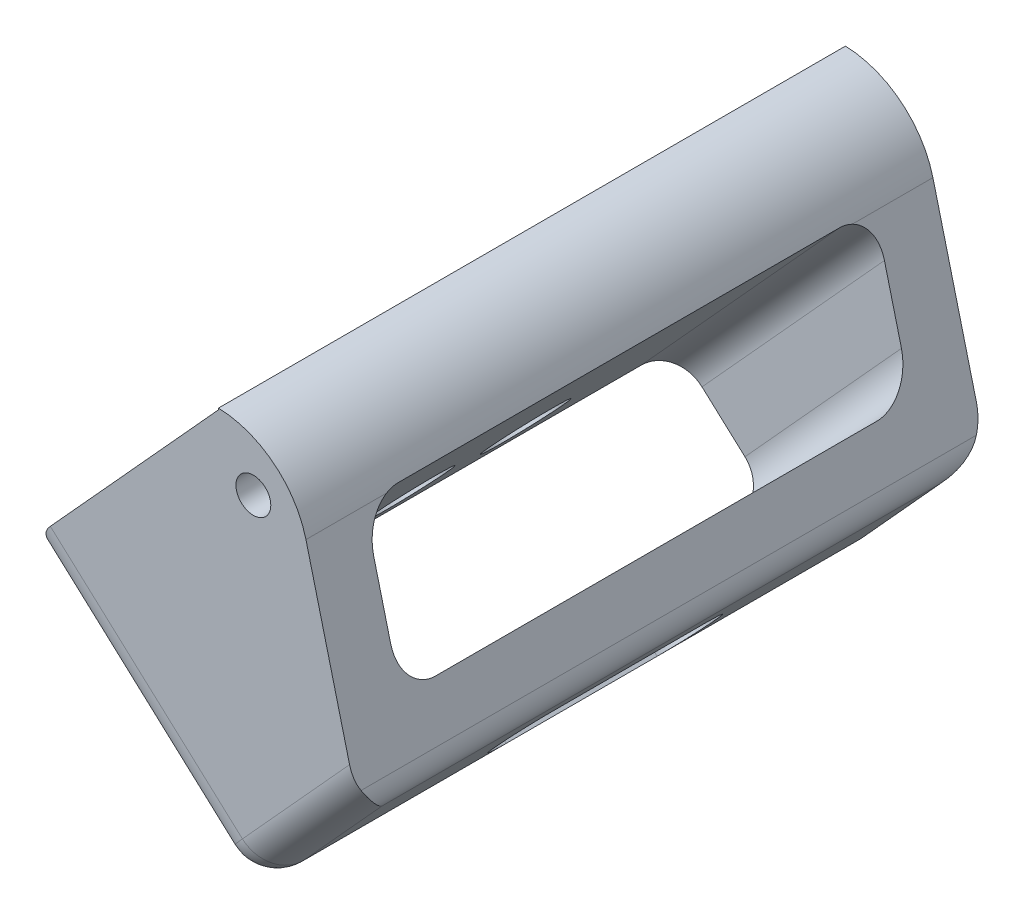
from build123d import *

# Parameters (mm, degrees)
SKETCH_1_W          = 6.01304928
SKETCH_1_H          = 10
SKETCH_1_R          = 1.5
EXTRUDE_1_DEPTH     = 54
EXTRUDE_2_DEPTH     = 54
SKETCH_3_W          = 11.000516989
SKETCH_3_H          = 44
CUT_EXTRUDE_1_DEPTH = 54
FILLET_1_R          = 3
SKETCH_4_R          = 1.5
CUT_EXTRUDE_2_DEPTH = 65.758340749
CUT_EXTRUDE_START   = -8
SKETCH_5_R          = 1.5
CUT_EXTRUDE_3_DEPTH = 8
CUT_EXTRUDE_START_2 = -2.5
SKETCH_6_R          = 3.25
SKETCH_6_R_2        = 1.5
CUT_EXTRUDE_4_DEPTH = 2.5
FILLET_2_R          = 8


with BuildPart() as part:
    # 草图1 → 凸台-拉伸1 (new body)
    with BuildSketch(Plane.XY):
        Rectangle(SKETCH_1_W, SKETCH_1_H)
        Circle(SKETCH_1_R, mode=Mode.SUBTRACT)
    extrude(amount=EXTRUDE_1_DEPTH)

    # 草图2 → 凸台-拉伸2 (add)
    with BuildSketch(Plane.XY.offset(54)):
        Polygon((-3.00652464, 4.869160707), (-5.333618016, 2.309357993), (-11.387673162, -4.350102667), (-19.506532138, -13.280847541), (-0.740319183, -30.341041136), (9.164728063, -19.445489164), (3.00652464, 5), (3.00652464, -5), (-3.00652464, -5), align=None)
    extrude(amount=-EXTRUDE_2_DEPTH)

    # 草图3 → 切除-拉伸1 (cut)
    with BuildSketch(Plane(origin=(-15.436861734, -16.980547908, 0), x_dir=(0.7399400733959437, -0.6726727939963125, 0), z_dir=(-0.6726727939963125, -0.7399400733959437, 0))):
        with Locations((9.361542588, 27)):
            Rectangle(SKETCH_3_W, SKETCH_3_H)
    extrude(amount=-CUT_EXTRUDE_1_DEPTH, mode=Mode.SUBTRACT)

    # 圆角1
    fillet_1_edges = [part.edges().sort_by_distance(p)[0] for p in [
        (-19.506532138, -13.280847541, 27),
        (4.21220444, -24.89326515, 54),
        (9.164728063, -19.445489164, 27),
        (-10.123425661, -21.810944338, 54),
        (-0.740319183, -30.341041136, 27),
        (4.21220444, -24.89326515, 0),
        (-10.123425661, -21.810944338, 0),
        (1.629252849, -20.301477526, 5),
        (-4.053507722, -10.199069972, 5),
        (-4.053507722, -10.199069972, 49),
        (1.629252849, -20.301477526, 49),
    ]]
    fillet(fillet_1_edges, radius=FILLET_1_R)

    # 草图4 → 切除-拉伸2 (cut, through all)
    with BuildSketch(Plane(origin=(-4.069670404, 3.699700367, 0), x_dir=(0, 0, 1), z_dir=(-0.7399400733959431, 0.6726727939963131, 0))):
        with Locations(Location((22, -16.948544778, 0), (0, 0, 270))):
            Circle(SKETCH_4_R)
        with Locations(Location((32, -16.948544778, 0), (0, 0, 270))):
            Circle(SKETCH_4_R)
    extrude(amount=-CUT_EXTRUDE_2_DEPTH, mode=Mode.SUBTRACT)

    # 草图5 → 切除-拉伸3 (cut)
    # profile 1 of 3: a face of its own
    with BuildSketch(Plane(origin=(14.696542551, -13.360493228, 0), x_dir=(0, 0, -1), z_dir=(0.7399400733959434, -0.6726727939963129, 0)).offset(CUT_EXTRUDE_START)):
        with BuildLine():
            Line((-33.5, -19.948544778), (-30.5, -19.948544778))
            ThreePointArc((-30.5, -19.948544778), (-27.5, -16.948544778), (-30.5, -13.948544778))
            Line((-30.5, -13.948544778), (-33.5, -13.948544778))
            ThreePointArc((-33.5, -13.948544778), (-36.5, -16.948544778), (-33.5, -19.948544778))
        make_face()
        with Locations(Location((-32, -16.948544778, 0), (0, 0, 270))):
            Circle(SKETCH_5_R, mode=Mode.SUBTRACT)
    # profile 2 of 3: a face of its own
    with BuildSketch(Plane(origin=(14.696542551, -13.360493228, 0), x_dir=(0, 0, -1), z_dir=(0.7399400733959434, -0.6726727939963129, 0)).offset(CUT_EXTRUDE_START)):
        with BuildLine():
            ThreePointArc((-23.5, -13.948544778), (-26.5, -16.948544778), (-23.5, -19.948544778))
            Line((-23.5, -19.948544778), (-30.5, -19.948544778))
            ThreePointArc((-30.5, -19.948544778), (-27.5, -16.948544778), (-30.5, -13.948544778))
            Line((-30.5, -13.948544778), (-23.5, -13.948544778))
        make_face()
    # profile 3 of 3: a face of its own
    with BuildSketch(Plane(origin=(14.696542551, -13.360493228, 0), x_dir=(0, 0, -1), z_dir=(0.7399400733959434, -0.6726727939963129, 0)).offset(CUT_EXTRUDE_START)):
        with BuildLine():
            Line((-23.5, -19.948544778), (-20.5, -19.948544778))
            ThreePointArc((-20.5, -19.948544778), (-17.5, -16.948544778), (-20.5, -13.948544778))
            Line((-20.5, -13.948544778), (-23.5, -13.948544778))
            ThreePointArc((-23.5, -13.948544778), (-26.5, -16.948544778), (-23.5, -19.948544778))
        make_face()
        with Locations(Location((-22, -16.948544778, 0), (0, 0, 270))):
            Circle(SKETCH_5_R, mode=Mode.SUBTRACT)
    extrude(amount=CUT_EXTRUDE_3_DEPTH, mode=Mode.SUBTRACT)

    # 草图6 → 切除-拉伸4 (cut)
    # profile 1 of 2: a face of its own
    with BuildSketch(Plane(origin=(2.857118835, -2.597380759, 0), x_dir=(0, 0, -1), z_dir=(0.7399400733959437, -0.6726727939963125, 0)).offset(CUT_EXTRUDE_START_2)):
        with Locations(Location((-32, -16.948544778, 0), (0, 0, 90))):
            Circle(SKETCH_6_R)
        with Locations(Location((-32, -16.948544778, 0), (0, 0, 270))):
            Circle(SKETCH_6_R_2, mode=Mode.SUBTRACT)
    # profile 2 of 2: a face of its own
    with BuildSketch(Plane(origin=(2.857118835, -2.597380759, 0), x_dir=(0, 0, -1), z_dir=(0.7399400733959437, -0.6726727939963125, 0)).offset(CUT_EXTRUDE_START_2)):
        with Locations(Location((-22, -16.948544778, 0), (0, 0, 90))):
            Circle(SKETCH_6_R)
        with Locations(Location((-22, -16.948544778, 0), (0, 0, 270))):
            Circle(SKETCH_6_R_2, mode=Mode.SUBTRACT)
    extrude(amount=CUT_EXTRUDE_4_DEPTH, mode=Mode.SUBTRACT)

    # 圆角2
    # the kernel refuses this fillet: 8 mm, written as the material it takes off along each edge
    with BuildSketch(Plane(origin=(3.00652464, 5, -15.578572112), x_dir=(0.24428365244033365, -0.9697038192924736, 0), z_dir=(0, 0, 1))) as fillet_2_piece_1:
        with BuildLine():
            CenterArc((6.231428845, -8), FILLET_2_R, 90, 74.267861836)
            Line((-1.468889641, -5.830876853), (-1.62289601, -5.78749439))
            ThreePointArc((-1.62289601, -5.78749439), (-0.889597431, -2.876353042), (-0.155152611, 0.039085384))
            Line((-0.155152611, 0.039085384), (0, 0.16))
            Line((0, 0.16), (6.231428845, 0.16))
            Line((6.231428845, 0.16), (6.231428845, 0))
        make_face()
    extrude(amount=85.157144223, mode=Mode.SUBTRACT)


solid = part.part
